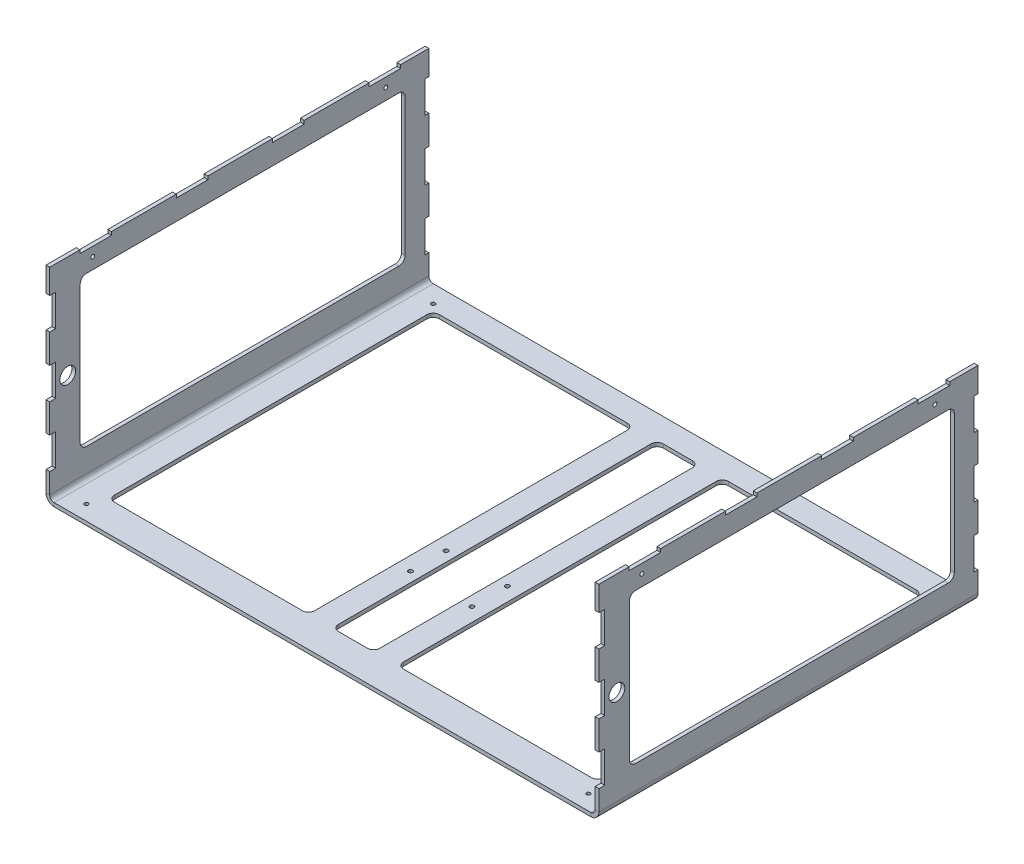
from build123d import *

# Parameters (mm, degrees)
SKETCH1_W                    = 444.5
SKETCH1_H                    = 304.8
BASE_FLANGE1_DEPTH           = 3
EDGE_FLANGE1_STRIP_W         = 19
EDGE_FLANGE1_STRIP_H         = 3
EDGE_FLANGE1_STRIP_CUT_DEPTH = 304.8
EDGE_FLANGE1_DEPTH           = 304.8
EDGE_FLANGE2_STRIP_W         = 19
EDGE_FLANGE2_STRIP_H         = 3
EDGE_FLANGE2_STRIP_CUT_DEPTH = 304.8
EDGE_FLANGE2_DEPTH           = 304.8
CUT_EXTRUDE1_DEPTH           = 10
CUT_EXTRUDE2_DEPTH           = 498.073857691
SKETCH19_W                   = 3.819778672
SKETCH19_H                   = 25.4
SKETCH19_W_2                 = 5.311570592
SKETCH19_W_3                 = 6.282257672
CUT_EXTRUDE3_DEPTH           = 2.7
SKETCH20_R                   = 6.35
CUT_EXTRUDE4_DEPTH           = 498.073857691
SKETCH21_W                   = 17.464493651
SKETCH21_H                   = 25.4
SKETCH21_W_2                 = 13.647096892
SKETCH21_W_3                 = 13.948700337
CUT_EXTRUDE5_DEPTH           = 4.7
MIRROR3_COPY_1_SKETCH_W      = 17.464493651
MIRROR3_COPY_1_SKETCH_H      = 25.4
MIRROR3_COPY_1_SKETCH_W_2    = 13.647096892
MIRROR3_COPY_1_SKETCH_W_3    = 13.948700337
MIRROR3_COPY_1_DEPTH         = 4.7
SKETCH22_W                   = 3
SKETCH22_H                   = 25.4
BOSS_EXTRUDE1_DEPTH          = 1.5
SKETCH23_R                   = 1.7
CUT_EXTRUDE6_DEPTH           = 10
SKETCH24_R                   = 1.55
CUT_EXTRUDE7_DEPTH           = 498.073857691
SKETCH25_R                   = 1.55
SKETCH25_R_2                 = 1.5
CUT_EXTRUDE8_DEPTH           = 315.479303771


# Sheet-metal steps are written as plain solids
with BuildPart() as part:
    # Sketch1 → Base-Flange1 (new body)
    with BuildSketch(Plane(origin=(0, 0, 0), x_dir=(1, 0, 0), z_dir=(0, 1, 0))):
        Rectangle(SKETCH1_W, SKETCH1_H)
    extrude(amount=-BASE_FLANGE1_DEPTH)

    # Edge-Flange1 strip (across the edge) → Edge-Flange1 strip cut (cut)
    with BuildSketch(Plane(origin=(-222.25, 0, -152.4), x_dir=(1, 0, 0), z_dir=(0, 0, 1))):
        with Locations((-3, -1.5)):
            Rectangle(EDGE_FLANGE1_STRIP_W, EDGE_FLANGE1_STRIP_H)
    extrude(amount=EDGE_FLANGE1_STRIP_CUT_DEPTH, mode=Mode.SUBTRACT)

    # Edge-Flange1 section (across the edge) → Edge-Flange1 (add)
    with BuildSketch(Plane(origin=(-222.25, 0, -152.4), x_dir=(1, 0, 0), z_dir=(0, 0, 1))):
        with BuildLine():
            Line((0, 3.5), (0, 162.1))
            Line((0, 162.1), (3, 162.1))
            Line((3, 162.1), (3, 3.5))
            ThreePointArc((3, 3.5), (4.025126266, 1.025126266), (6.5, 0))
            Line((6.5, 0), (6.5, -3))
            ThreePointArc((6.5, -3), (1.903805922, -1.096194078), (0, 3.5))
        make_face()
    extrude(amount=EDGE_FLANGE1_DEPTH)

    # Edge-Flange2 strip (across the edge) → Edge-Flange2 strip cut (cut)
    with BuildSketch(Plane(origin=(222.25, 0, 152.4), x_dir=(-1, 0, 0), z_dir=(0, 0, -1))):
        with Locations((-3, -1.5)):
            Rectangle(EDGE_FLANGE2_STRIP_W, EDGE_FLANGE2_STRIP_H)
    extrude(amount=EDGE_FLANGE2_STRIP_CUT_DEPTH, mode=Mode.SUBTRACT)

    # Edge-Flange2 section (across the edge) → Edge-Flange2 (add)
    with BuildSketch(Plane(origin=(222.25, 0, 152.4), x_dir=(-1, 0, 0), z_dir=(0, 0, -1))):
        with BuildLine():
            Line((0, 3.5), (0, 162.1))
            Line((0, 162.1), (3, 162.1))
            Line((3, 162.1), (3, 3.5))
            ThreePointArc((3, 3.5), (4.025126266, 1.025126266), (6.5, 0))
            Line((6.5, 0), (6.5, -3))
            ThreePointArc((6.5, -3), (1.903805922, -1.096194078), (0, 3.5))
        make_face()
    extrude(amount=EDGE_FLANGE2_DEPTH)

    # Sketch17 → Cut-Extrude1 (cut)
    with BuildSketch(Plane(origin=(0, 0, 0), x_dir=(1, 0, 0), z_dir=(0, 1, 0))):
        with BuildLine():
            Line((-191.7, 133.35), (-40.7, 133.35))
            ThreePointArc((-40.7, 133.35), (-37.164466094, 131.885533906), (-35.7, 128.35))
            Line((-35.7, 128.35), (-35.7, -122.9))
            ThreePointArc((-35.7, -122.9), (-37.164466094, -126.435533906), (-40.7, -127.9))
            Line((-40.7, -127.9), (-191.7, -127.9))
            ThreePointArc((-191.7, -127.9), (-195.235533906, -126.435533906), (-196.7, -122.9))
            Line((-196.7, -122.9), (-196.7, 128.35))
            ThreePointArc((-196.7, 128.35), (-195.235533906, 131.885533906), (-191.7, 133.35))
        make_face()
        with BuildLine():
            Line((196.7, 128.35), (196.7, -122.9))
            ThreePointArc((196.7, -122.9), (195.235533906, -126.435533906), (191.7, -127.9))
            Line((191.7, -127.9), (40.7, -127.9))
            ThreePointArc((40.7, -127.9), (37.164466094, -126.435533906), (35.7, -122.9))
            Line((35.7, -122.9), (35.7, 128.35))
            ThreePointArc((35.7, 128.35), (37.164466094, 131.885533906), (40.7, 133.35))
            Line((40.7, 133.35), (191.7, 133.35))
            ThreePointArc((191.7, 133.35), (195.235533906, 131.885533906), (196.7, 128.35))
        make_face()
        with BuildLine():
            Line((-11.65, 133.35), (11.65, 133.35))
            ThreePointArc((11.65, 133.35), (15.185533906, 131.885533906), (16.65, 128.35))
            Line((16.65, 128.35), (16.65, -122.9))
            ThreePointArc((16.65, -122.9), (15.185533906, -126.435533906), (11.65, -127.9))
            Line((11.65, -127.9), (-11.65, -127.9))
            ThreePointArc((-11.65, -127.9), (-15.185533906, -126.435533906), (-16.65, -122.9))
            Line((-16.65, -122.9), (-16.65, 128.35))
            ThreePointArc((-16.65, 128.35), (-15.185533906, 131.885533906), (-11.65, 133.35))
        make_face()
    extrude(amount=-CUT_EXTRUDE1_DEPTH, mode=Mode.SUBTRACT)

    # Sketch18 → Cut-Extrude2 (cut, through all)
    with BuildSketch(Plane(origin=(222.25, 0, 0), x_dir=(0, 0, -1), z_dir=(1, 0, 0))):
        with BuildLine():
            Line((-122.9, 143.05), (128.35, 143.05))
            ThreePointArc((128.35, 143.05), (131.885533906, 141.585533906), (133.35, 138.05))
            Line((133.35, 138.05), (133.35, 27.55))
            ThreePointArc((133.35, 27.55), (131.885533906, 24.014466094), (128.35, 22.55))
            Line((128.35, 22.55), (-122.9, 22.55))
            ThreePointArc((-122.9, 22.55), (-126.435533906, 24.014466094), (-127.9, 27.55))
            Line((-127.9, 27.55), (-127.9, 138.05))
            ThreePointArc((-127.9, 138.05), (-126.435533906, 141.585533906), (-122.9, 143.05))
        make_face()
    extrude(amount=-CUT_EXTRUDE2_DEPTH, mode=Mode.SUBTRACT)

    # Sketch19 → Cut-Extrude3 (cut)
    with BuildSketch(Plane(origin=(0, 162.1, 0), x_dir=(1, 0, 0), z_dir=(0, 1, 0))):
        with Locations((220.340110664, 117)):
            Rectangle(SKETCH19_W, SKETCH19_H)
        with Locations((220.340110664, 39.4667)):
            Rectangle(SKETCH19_W, SKETCH19_H)
        with Locations((219.594214704, -37.9666)):
            Rectangle(SKETCH19_W_2, SKETCH19_H)
        with Locations((219.108871164, -115.4)):
            Rectangle(SKETCH19_W_3, SKETCH19_H)
    cut_extrude3 = extrude(amount=-CUT_EXTRUDE3_DEPTH, mode=Mode.SUBTRACT)

    # Mirror1: Cut-Extrude3 across plane
    add(cut_extrude3.mirror(Plane(origin=(0, 0, 0), x_dir=(0, 0, 1), z_dir=(1, 0, 0))), mode=Mode.SUBTRACT)

    # Sketch20 → Cut-Extrude4 (cut, through all)
    with BuildSketch(Plane(origin=(222.25, 0, 0), x_dir=(0, 0, -1), z_dir=(1, 0, 0))):
        with Locations(Location((-137.9, 79.55, 0), (0, 0, 90))):
            Circle(SKETCH20_R)
    extrude(amount=-CUT_EXTRUDE4_DEPTH, mode=Mode.SUBTRACT)

    # Sketch21 → Cut-Extrude5 (cut)
    with BuildSketch(Plane.XY.offset(152.4)):
        with Locations((-218.916310312, 129.65)):
            Rectangle(SKETCH21_W, SKETCH21_H)
        with Locations((-220.825008691, 81.05)):
            Rectangle(SKETCH21_W_2, SKETCH21_H)
        with Locations((-219.777298677, 32.5)):
            Rectangle(SKETCH21_W_3, SKETCH21_H)
    cut_extrude5 = extrude(amount=-CUT_EXTRUDE5_DEPTH, mode=Mode.SUBTRACT)

    # Mirror2: Cut-Extrude5 across plane
    add(cut_extrude5.mirror(Plane(origin=(0, 0, 0), x_dir=(0, 0, 1), z_dir=(1, 0, 0))), mode=Mode.SUBTRACT)

    # Mirror3: Cut-Extrude5 across plane
    add(cut_extrude5.mirror(Plane.XY), mode=Mode.SUBTRACT)

    # Mirror3 copy 1 sketch → Mirror3 copy 1 (cut)
    with BuildSketch(Plane(origin=(0, 0, -152.4), x_dir=(-1, 0, 0), z_dir=(0, 0, -1))):
        with Locations((-218.916310312, 129.65)):
            Rectangle(MIRROR3_COPY_1_SKETCH_W, MIRROR3_COPY_1_SKETCH_H)
        with Locations((-220.825008691, 81.05)):
            Rectangle(MIRROR3_COPY_1_SKETCH_W_2, MIRROR3_COPY_1_SKETCH_H)
        with Locations((-219.777298677, 32.5)):
            Rectangle(MIRROR3_COPY_1_SKETCH_W_3, MIRROR3_COPY_1_SKETCH_H)
    extrude(amount=-MIRROR3_COPY_1_DEPTH, mode=Mode.SUBTRACT)

    # Sketch22 → Boss-Extrude1 (add)
    with BuildSketch(Plane(origin=(0, 0, -147.7), x_dir=(-1, 0, 0), z_dir=(0, 0, -1))):
        with Locations((-220.75, 129.65)):
            Rectangle(SKETCH22_W, SKETCH22_H)
        with Locations((-220.75, 81.05)):
            Rectangle(SKETCH22_W, SKETCH22_H)
        with Locations((-220.75, 32.5)):
            Rectangle(SKETCH22_W, SKETCH22_H)
        with Locations((220.75, 32.5)):
            Rectangle(SKETCH22_W, SKETCH22_H)
        with Locations((220.75, 81.05)):
            Rectangle(SKETCH22_W, SKETCH22_H)
        with Locations((220.75, 129.65)):
            Rectangle(SKETCH22_W, SKETCH22_H)
    extrude(amount=BOSS_EXTRUDE1_DEPTH)

    # Sketch23 → Cut-Extrude6 (cut)
    with BuildSketch(Plane(origin=(0, 0, 0), x_dir=(1, 0, 0), z_dir=(0, 1, 0))):
        with Locations(Location((24.68, -56.900000112, 0), (0, 0, 270))):
            Circle(SKETCH23_R)
        with Locations(Location((24.68, -28.400000112, 0), (0, 0, 270))):
            Circle(SKETCH23_R)
        with Locations(Location((-24.683448016, -56.900000112, 0), (0, 0, 270))):
            Circle(SKETCH23_R)
        with Locations(Location((-24.683448016, -28.400000112, 0), (0, 0, 270))):
            Circle(SKETCH23_R)
    extrude(amount=-CUT_EXTRUDE6_DEPTH, mode=Mode.SUBTRACT)

    # Sketch24 → Cut-Extrude7 (cut, through all)
    with BuildSketch(Plane(origin=(222.25, 0, 0), x_dir=(0, 0, -1), z_dir=(1, 0, 0))):
        with Locations(Location((117.8, 152.1, 0), (0, 0, 90))):
            Circle(SKETCH24_R)
        with Locations(Location((-117.8, 152.1, 0), (0, 0, 90))):
            Circle(SKETCH24_R)
    extrude(amount=-CUT_EXTRUDE7_DEPTH, mode=Mode.SUBTRACT)

    # Sketch25 → Cut-Extrude8 (cut, through all)
    with BuildSketch(Plane(origin=(0, 0, 0), x_dir=(1, 0, 0), z_dir=(0, 1, 0))):
        with Locations(Location((-201.75, 138.375, 0), (0, 0, 270))):
            Circle(SKETCH25_R)
        with Locations(Location((-201.75, -140.375, 0), (0, 0, 270))):
            Circle(SKETCH25_R_2)
        with Locations(Location((201.75, 138.375, 0), (0, 0, 270))):
            Circle(SKETCH25_R)
        with Locations(Location((201.75, -140.375, 0), (0, 0, 270))):
            Circle(SKETCH25_R_2)
    extrude(amount=-CUT_EXTRUDE8_DEPTH, mode=Mode.SUBTRACT)


solid = part.part
